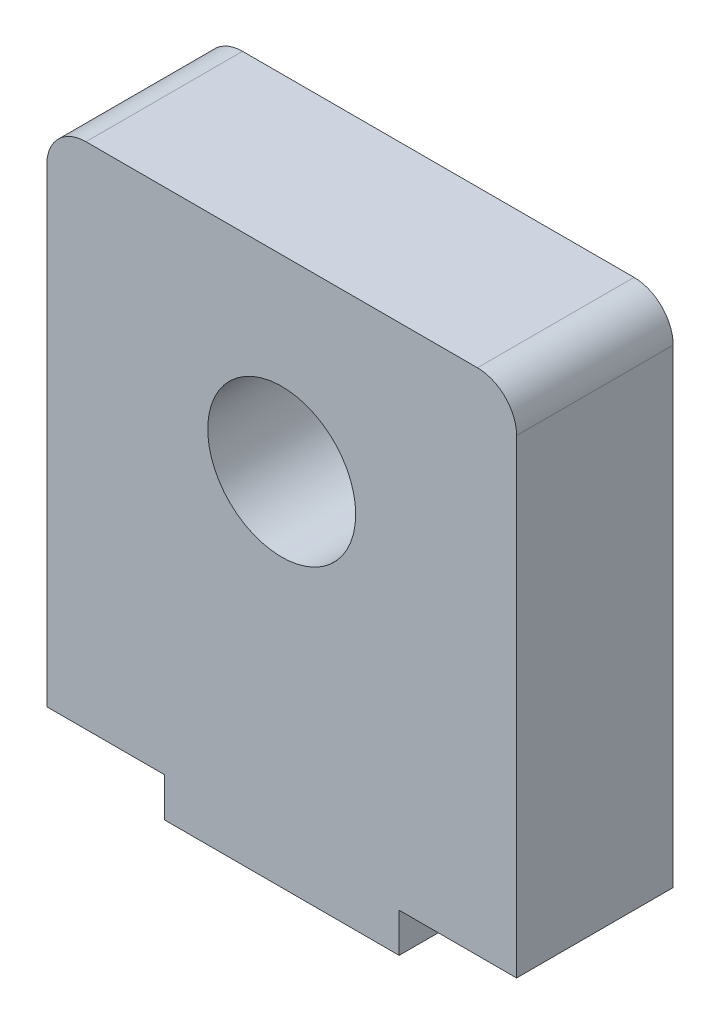
from build123d import *

# Parameters (mm, degrees)
SKETCH1_R           = 3
BOSS_EXTRUDE1_DEPTH = 6.35
FILLET1_R           = 1.5875


with BuildPart() as part:
    # Sketch1 → Boss-Extrude1 (new body)
    with BuildSketch(Plane.XY):
        Polygon((9.525, 11.1125), (-9.525, 11.1125), (-9.525, -9.525), (-4.7625, -9.525), (-4.7625, -11.1125), (4.7625, -11.1125), (4.7625, -9.525), (9.525, -9.525), align=None)
        with Locations((0, 3.4925)):
            Circle(SKETCH1_R, mode=Mode.SUBTRACT)
    extrude(amount=BOSS_EXTRUDE1_DEPTH)

    # Fillet1
    fillet1_edges = [part.edges().sort_by_distance(p)[0] for p in [
        (9.525, 11.1125, 3.175),
        (-9.525, 11.1125, 3.175),
    ]]
    fillet(fillet1_edges, radius=FILLET1_R)


solid = part.part
